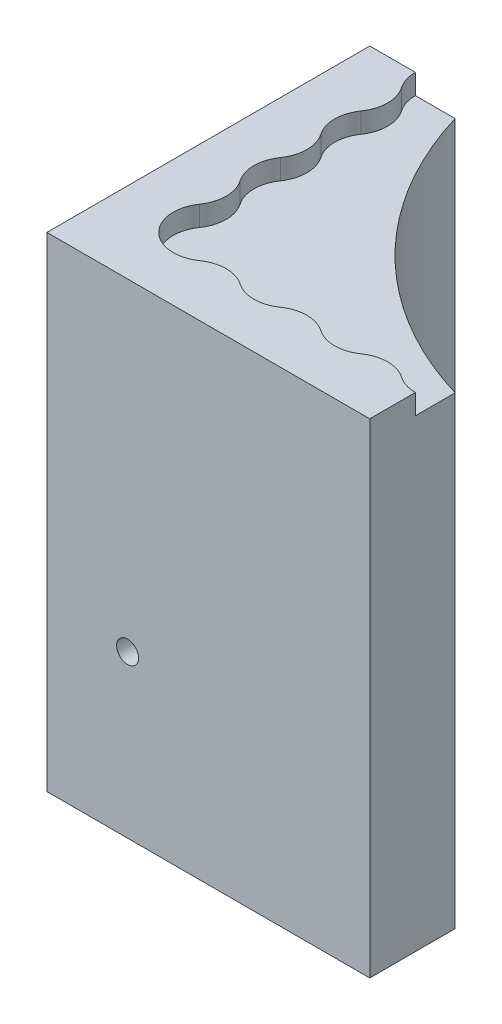
from build123d import *

# Parameters (mm, degrees)
SKETCH1_W                 = 50.8
SKETCH1_H                 = 50.8
BOSS_EXTRUDE1_DEPTH       = 76.2
CUT_EXTRUDE1_DEPTH        = 3.175
SKETCH3_R                 = 55.5625
CUT_EXTRUDE2_DEPTH        = 105.726882891
F_8_32_TAPPED_HOLE1_D     = 3.4544
F_8_32_TAPPED_HOLE1_DEPTH = 10.70864
F_8_32_TAPPED_HOLE1_TIP   = 1.037806461
F_8_32_TAPPED_HOLE2_D     = 3.4544
F_8_32_TAPPED_HOLE2_DEPTH = 10.70864
F_8_32_TAPPED_HOLE2_TIP   = 1.037806461


with BuildPart() as part:
    # Sketch1 → Boss-Extrude1 (new body)
    with BuildSketch(Plane(origin=(0, 0, 0), x_dir=(1, 0, 0), z_dir=(0, 1, 0))):
        with Locations((25.4, 25.4)):
            Rectangle(SKETCH1_W, SKETCH1_H)
    extrude(amount=BOSS_EXTRUDE1_DEPTH)

    # Sketch2 → Cut-Extrude1 (cut)
    with BuildSketch(Plane(origin=(0, 76.2, 0), x_dir=(1, 0, 0), z_dir=(0, 1, 0))):
        with BuildLine():
            Line((130.016993909, 125.017737196), (134.25782275, 78.573759143))
            ThreePointArc((134.25782275, 78.573759143), (134.034685181, 75.298190088), (132.798116214, 72.256802214))
            ThreePointArc((132.798116214, 72.256802214), (130.01096738, 66.280890285), (128.580118229, 59.844090402))
            ThreePointArc((128.580118229, 59.844090402), (125.846501332, 47.24207899), (120.576283082, 35.473130329))
            ThreePointArc((120.576283082, 35.473130329), (120.013426501, 34.114565768), (119.824473194, 32.656209898))
            ThreePointArc((119.824473194, 32.656209898), (117.90735564, 28.45485307), (113.469501546, 27.177281171))
            ThreePointArc((113.469501546, 27.177281171), (106.116591491, 23.83727612), (106.198458812, 15.761744078))
            ThreePointArc((106.198458812, 15.761744078), (105.465515747, 8.75311664), (98.443142857, 8.166309094))
            ThreePointArc((98.443142857, 8.166309094), (95.25, 9.168506799), (92.056857143, 8.166309094))
            ThreePointArc((92.056857143, 8.166309094), (88.9, 7.1755), (85.743142857, 8.166309094))
            ThreePointArc((85.743142857, 8.166309094), (82.55, 9.168506799), (79.356857143, 8.166309094))
            ThreePointArc((79.356857143, 8.166309094), (76.212257074, 7.175513597), (73.063291467, 8.152345678))
            ThreePointArc((73.063291467, 8.152345678), (69.907489389, 9.140393728), (66.74574768, 8.171520637))
            ThreePointArc((66.74574768, 8.171520637), (63.508942298, 7.175501389), (60.273525168, 8.176020964))
            ThreePointArc((60.273525168, 8.176020964), (57.10532095, 9.149271709), (53.943097961, 8.156759366))
            ThreePointArc((53.943097961, 8.156759366), (50.791625748, 7.175506347), (47.643142857, 8.166309094))
            ThreePointArc((47.643142857, 8.166309094), (44.45, 9.168506799), (41.256857143, 8.166309094))
            ThreePointArc((41.256857143, 8.166309094), (38.1, 7.1755), (34.943142857, 8.166309094))
            ThreePointArc((34.943142857, 8.166309094), (31.75, 9.168506799), (28.556857143, 8.166309094))
            ThreePointArc((28.556857143, 8.166309094), (25.4, 7.1755), (22.243142857, 8.166309094))
            ThreePointArc((22.243142857, 8.166309094), (19.05, 9.168506799), (15.856857143, 8.166309094))
            ThreePointArc((15.856857143, 8.166309094), (8.793588587, 8.793588587), (8.166309094, 15.856857143))
            ThreePointArc((8.166309094, 15.856857143), (9.168506799, 19.05), (8.166309094, 22.243142857))
            ThreePointArc((8.166309094, 22.243142857), (7.1755, 25.4), (8.166309094, 28.556857143))
            ThreePointArc((8.166309094, 28.556857143), (9.168506799, 31.75), (8.166309094, 34.943142857))
            ThreePointArc((8.166309094, 34.943142857), (7.1755, 38.1), (8.166309094, 41.256857143))
            ThreePointArc((8.166309094, 41.256857143), (9.168506799, 44.45), (8.166309094, 47.643142857))
            ThreePointArc((8.166309094, 47.643142857), (7.175506347, 50.791625748), (8.156759366, 53.943097961))
            ThreePointArc((8.156759366, 53.943097961), (9.149271709, 57.10532095), (8.176020964, 60.273525168))
            ThreePointArc((8.176020964, 60.273525168), (7.175501389, 63.508942298), (8.171520637, 66.74574768))
            ThreePointArc((8.171520637, 66.74574768), (9.140393728, 69.907489389), (8.152345678, 73.063291467))
            ThreePointArc((8.152345678, 73.063291467), (7.175513597, 76.212257074), (8.166309094, 79.356857143))
            ThreePointArc((8.166309094, 79.356857143), (9.168506799, 82.55), (8.166309094, 85.743142857))
            ThreePointArc((8.166309094, 85.743142857), (7.1755, 88.9), (8.166309094, 92.056857143))
            ThreePointArc((8.166309094, 92.056857143), (9.168506799, 95.25), (8.166309094, 98.443142857))
            ThreePointArc((8.166309094, 98.443142857), (8.75311664, 105.465515747), (15.761744078, 106.198458812))
            ThreePointArc((15.761744078, 106.198458812), (23.83727612, 106.116591491), (27.177281171, 113.469501546))
            ThreePointArc((27.177281171, 113.469501546), (28.45485307, 117.90735564), (32.656209898, 119.824473194))
            ThreePointArc((32.656209898, 119.824473194), (34.114565768, 120.013426501), (35.473130329, 120.576283082))
            ThreePointArc((35.473130329, 120.576283082), (47.24207899, 125.846501332), (59.844090402, 128.580118229))
            ThreePointArc((59.844090402, 128.580118229), (68.705211612, 130.952457845), (76.452938417, 135.863689229))
            ThreePointArc((76.452938417, 135.863689229), (80.625736152, 138.0725352), (85.345346996, 138.201045691))
            Line((85.345346996, 138.201045691), (125.626948268, 129.926898817))
            ThreePointArc((125.626948268, 129.926898817), (128.63345164, 128.197989094), (130.016993909, 125.017737196))
        make_face()
    extrude(amount=-CUT_EXTRUDE1_DEPTH, mode=Mode.SUBTRACT)

    # Sketch3 → Cut-Extrude2 (cut, through all)
    with BuildSketch(Plane(origin=(0, 76.2, 0), x_dir=(1, 0, 0), z_dir=(0, 1, 0))):
        with Locations((66.675, 66.675)):
            Circle(SKETCH3_R)
    extrude(amount=-CUT_EXTRUDE2_DEPTH, mode=Mode.SUBTRACT)

    # #8-32 Tapped Hole1
    with Locations(Plane(origin=(393.7, -15.875, 0), x_dir=(1, 0, 0), z_dir=(0, 0, 1))):
        with Locations((-381, 41.275)):
            Hole(F_8_32_TAPPED_HOLE1_D / 2, depth=F_8_32_TAPPED_HOLE1_DEPTH)
            with Locations((0, 0, -(F_8_32_TAPPED_HOLE1_DEPTH + F_8_32_TAPPED_HOLE1_TIP / 2))):  # 118° drill point
                Cone(0, F_8_32_TAPPED_HOLE1_D / 2, F_8_32_TAPPED_HOLE1_TIP, mode=Mode.SUBTRACT)

    # #8-32 Tapped Hole2
    with Locations(Plane(origin=(0, -15.875, -393.7), x_dir=(0, 0, 1), z_dir=(-1, 0, 0))):
        with Locations((381, 41.275)):
            Hole(F_8_32_TAPPED_HOLE2_D / 2, depth=F_8_32_TAPPED_HOLE2_DEPTH)
            with Locations((0, 0, -(F_8_32_TAPPED_HOLE2_DEPTH + F_8_32_TAPPED_HOLE2_TIP / 2))):  # 118° drill point
                Cone(0, F_8_32_TAPPED_HOLE2_D / 2, F_8_32_TAPPED_HOLE2_TIP, mode=Mode.SUBTRACT)


solid = part.part
